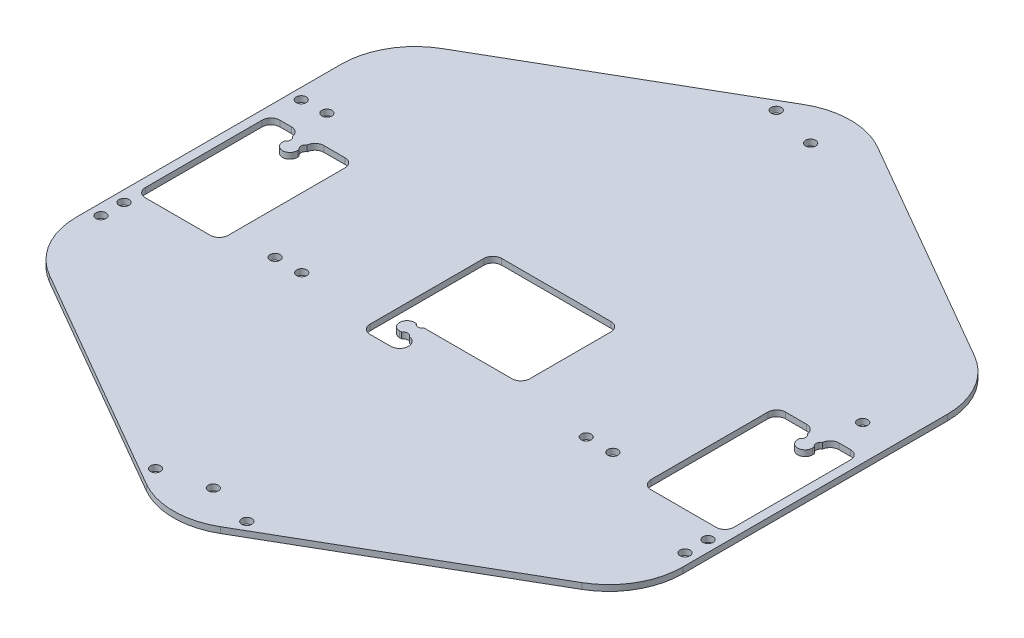
from build123d import *

# Parameters (mm, degrees)
BOSS_EXTRU_1_DEPTH                  = 2
ESQUISSE2_W                         = 28
ESQUISSE2_H                         = 45.5
ENL_V_MAT_EXTRU_1_DEPTH             = 157.584109453
BOSS_EXTRU_2_DEPTH                  = 2
ESQUISSE11_R                        = 1.6
ENL_V_MAT_EXTRU_2_DEPTH             = 157.584109453
CONG_7_R                            = 3
CONG_8_R                            = 25
DIAM_TRE_DU_PER_AGE_3_4_3_4_2_D     = 3.4
DIAM_TRE_DU_PER_AGE_3_4_3_4_2_DEPTH = 3
DIAM_TRE_DU_PER_AGE_3_4_3_4_2_TIP   = 1.021463052
D_GAGEMENT_M31_D                    = 3.4
D_GAGEMENT_M33_D                    = 3.4
D_GAGEMENT_M33_DEPTH                = 7
D_GAGEMENT_M33_TIP                  = 1.021463052
ENL_V_MAT_EXTRU_3_DEPTH             = 154.681644706
BOSS_EXTRU_3_DEPTH                  = 2
ESQUISSE40_R                        = 1.6
ENL_V_MAT_EXTRU_4_DEPTH             = 154.681644706
CONG_9_R                            = 3


with BuildPart() as part:
    # Esquisse1 → Boss.-Extru.1 (new body)
    with BuildSketch(Plane(origin=(0, 0, 0), x_dir=(1, 0, 0), z_dir=(0, 1, 0))):
        Polygon((-102.5, 59.178402592), (-102.5, -59.178402592), (0, -118.356805184), (102.5, -59.178402592), (102.5, 59.178402592), (0, 118.356805184), align=None)
    extrude(amount=BOSS_EXTRU_1_DEPTH)

    # Esquisse2 → Enlèv. mat.-Extru.1 (cut, through all)
    with BuildSketch(Plane(origin=(0, 2, 0), x_dir=(1, 0, 0), z_dir=(0, 1, 0))):
        with Locations((-85.5, -4.75)):
            Rectangle(ESQUISSE2_W, ESQUISSE2_H)
        with Locations((85.5, -4.75)):
            Rectangle(ESQUISSE2_W, ESQUISSE2_H)
    extrude(amount=-ENL_V_MAT_EXTRU_1_DEPTH, mode=Mode.SUBTRACT)

    # Esquisse10 → Boss.-Extru.2 (add)
    with BuildSketch(Plane(origin=(0, 2, 0), x_dir=(1, 0, 0), z_dir=(0, 1, 0))):
        with BuildLine():
            Line((89.6, 18), (89.6, 12))
            ThreePointArc((89.6, 12), (87.1, 9.5), (84.6, 12))
            Line((84.6, 12), (84.6, 18))
            Line((84.6, 18), (89.6, 18))
        make_face()
    boss_extru_2 = extrude(amount=-BOSS_EXTRU_2_DEPTH)

    # Esquisse11 → Enlèv. mat.-Extru.2 (cut, through all)
    with BuildSketch(Plane(origin=(0, 2, 0), x_dir=(1, 0, 0), z_dir=(0, 1, 0))):
        with Locations((83.75, 14)):
            Circle(ESQUISSE11_R)
        with Locations((90.45, 14)):
            Circle(ESQUISSE11_R)
    enl_v_mat_extru_2 = extrude(amount=-ENL_V_MAT_EXTRU_2_DEPTH, mode=Mode.SUBTRACT)

    # Symétrie4: Boss.-Extru.2, Enlèv. mat.-Extru.2 across plane
    add(boss_extru_2.mirror(Plane(origin=(0, 0, 0), x_dir=(0, 0, 1), z_dir=(1, 0, 0))))
    add(enl_v_mat_extru_2.mirror(Plane(origin=(0, 0, 0), x_dir=(0, 0, 1), z_dir=(1, 0, 0))), mode=Mode.SUBTRACT)

    # Congé7
    # the kernel refuses this fillet: 3 mm, written as the material it adds along each edge
    with BuildSketch(Plane(origin=(-89.6, 2, -18), x_dir=(0, 0, 1), z_dir=(0, -1, 0)), Plane(origin=(84.6, 2, -18), x_dir=(0, 0, 1), z_dir=(0, -1, 0))) as cong_7_piece_1:
        with BuildLine():
            CenterArc((3, 2.978856885), CONG_7_R, 180, 83.193609184)
            Line((0, 2.978856885), (-0.06, 2.978856885))
            Line((-0.06, 2.978856885), (-0.06, 0))
            Line((-0.06, 0), (0, -0.06))
            ThreePointArc((0, -0.06), (1.322227914, -0.06), (2.637344945, -0.059577138))
            Line((2.637344945, -0.059577138), (2.644455829, 0))
        make_face()
    extrude(amount=2)
    with BuildSketch(Plane(origin=(-71.5, 2, -18), x_dir=(0, 0, 1), z_dir=(0, -1, 0)), Plane(origin=(71.5, 2, -18), x_dir=(1, 0, 0), z_dir=(0, -1, 0)), Plane(origin=(-99.5, 2, -18), x_dir=(1, 0, 0), z_dir=(0, -1, 0)), Plane(origin=(-99.5, 2, 27.5), x_dir=(0, 0, -1), z_dir=(0, -1, 0)), Plane(origin=(99.5, 2, 27.5), x_dir=(-1, 0, 0), z_dir=(0, -1, 0)), Plane(origin=(99.5, 2, -18), x_dir=(0, 0, 1), z_dir=(0, -1, 0))) as cong_7_piece_2:
        with BuildLine():
            CenterArc((CONG_7_R, CONG_7_R), CONG_7_R, 180, 90)
            Line((0, CONG_7_R), (-CONG_7_R * 0.02, CONG_7_R))
            Line((-CONG_7_R * 0.02, CONG_7_R), (-CONG_7_R * 0.02, -CONG_7_R * 0.02))
            Line((-CONG_7_R * 0.02, -CONG_7_R * 0.02), (CONG_7_R, -CONG_7_R * 0.02))
            Line((CONG_7_R, -CONG_7_R * 0.02), (CONG_7_R, 0))
        make_face()
    extrude(amount=2)
    with BuildSketch(Plane(origin=(-84.6, 2, -18), x_dir=(1, 0, 0), z_dir=(0, -1, 0)), Plane(origin=(89.6, 2, -18), x_dir=(1, 0, 0), z_dir=(0, -1, 0))) as cong_7_piece_3:
        with BuildLine():
            CenterArc((2.978856885, 3), CONG_7_R, 186.806390816, 83.193609184)
            Line((0, 2.644455829), (-0.059577138, 2.637344945))
            ThreePointArc((-0.059577138, 2.637344945), (-0.06, 1.322227914), (-0.06, 0))
            Line((-0.06, 0), (0, -0.06))
            Line((0, -0.06), (2.978856885, -0.06))
            Line((2.978856885, -0.06), (2.978856885, 0))
        make_face()
    extrude(amount=2)
    with BuildSketch(Plane(origin=(-71.5, 2, 27.5), x_dir=(0, 0, -1), z_dir=(0, -1, 0)), Plane(origin=(71.5, 2, 27.5), x_dir=(1, 0, 0), z_dir=(0, -1, 0))) as cong_7_piece_4:
        with BuildLine():
            CenterArc((CONG_7_R, -CONG_7_R), CONG_7_R, 90, 90)
            Line((0, -CONG_7_R), (-CONG_7_R * 0.02, -CONG_7_R))
            Line((-CONG_7_R * 0.02, -CONG_7_R), (-CONG_7_R * 0.02, CONG_7_R * 0.02))
            Line((-CONG_7_R * 0.02, CONG_7_R * 0.02), (CONG_7_R, CONG_7_R * 0.02))
            Line((CONG_7_R, CONG_7_R * 0.02), (CONG_7_R, 0))
        make_face()
    extrude(amount=2)

    # Congé8
    cong_8_edges = [part.edges().sort_by_distance(p)[0] for p in [
        (0, 1, -118.356805184),
        (102.5, 1, -59.178402592),
        (102.5, 1, 59.178402592),
        (0, 1, 118.356805184),
        (-102.5, 1, 59.178402592),
        (-102.5, 1, -59.178402592),
    ]]
    fillet(cong_8_edges, radius=CONG_8_R)

    # Diamètre du perçage Ø3.4 (3.4)2
    with Locations(Plane(origin=(0, 2, 0), x_dir=(-1, 0, 0), z_dir=(0, 1, 0))):
        with Locations((0, -101), (0, 101)):
            Hole(DIAM_TRE_DU_PER_AGE_3_4_3_4_2_D / 2, depth=DIAM_TRE_DU_PER_AGE_3_4_3_4_2_DEPTH)
            with Locations((0, 0, -(DIAM_TRE_DU_PER_AGE_3_4_3_4_2_DEPTH + DIAM_TRE_DU_PER_AGE_3_4_3_4_2_TIP / 2))):  # 118° drill point
                Cone(0, DIAM_TRE_DU_PER_AGE_3_4_3_4_2_D / 2, DIAM_TRE_DU_PER_AGE_3_4_3_4_2_TIP, mode=Mode.SUBTRACT)

    # Dégagement M31 (through all)
    with Locations(Plane(origin=(0, 0, 0), x_dir=(-1, 0, 0), z_dir=(0, -1, 0))):
        with Locations((48.1, -23), (57.1, -23), (-57.1, -23), (-48.1, -23)):
            Hole(D_GAGEMENT_M31_D / 2)

    # Dégagement M33
    with Locations(Plane(origin=(0, 0, 0), x_dir=(-1, 0, 0), z_dir=(0, -1, 0))):
        with Locations((15.43813191, -105.113468551), (-15.43813191, -105.113468551), (-98.75, -40.25), (-98.75, -32.45), (-90.594469683, 27.994469683), (15.43813191, 104.789291724), (98.85, 27.55), (90.594469683, 27.994469683), (98.75, -40.25), (98.75, -32.45)):
            Hole(D_GAGEMENT_M33_D / 2, depth=D_GAGEMENT_M33_DEPTH)
            with Locations((0, 0, -(D_GAGEMENT_M33_DEPTH + D_GAGEMENT_M33_TIP / 2))):  # 118° drill point
                Cone(0, D_GAGEMENT_M33_D / 2, D_GAGEMENT_M33_TIP, mode=Mode.SUBTRACT)

    # Esquisse38 → Enlèv. mat.-Extru.3 (cut, through all)
    with BuildSketch(Plane(origin=(0, 2, 0), x_dir=(1, 0, 0), z_dir=(0, 1, 0))):
        Polygon((21.5, -18.5), (-8.5, -18.5), (-8.5, -29.5), (-21.5, -29.5), (-21.5, 15), (21.5, 15), align=None)
    extrude(amount=-ENL_V_MAT_EXTRU_3_DEPTH, mode=Mode.SUBTRACT)

    # Esquisse39 → Boss.-Extru.3 (add)
    with BuildSketch(Plane(origin=(0, 2, 0), x_dir=(1, 0, 0), z_dir=(0, 1, 0))):
        with BuildLine():
            Line((-8.5, -23.5), (-14.5, -23.5))
            ThreePointArc((-14.5, -23.5), (-17, -21), (-14.5, -18.5))
            Line((-14.5, -18.5), (-8.5, -18.5))
            ThreePointArc((-8.5, -18.5), (-6, -21), (-8.5, -23.5))
        make_face()
    extrude(amount=-BOSS_EXTRU_3_DEPTH)

    # Esquisse40 → Enlèv. mat.-Extru.4 (cut, through all)
    with BuildSketch(Plane(origin=(0, 2, 0), x_dir=(1, 0, 0), z_dir=(0, 1, 0))):
        with Locations((-12.5, -17.65)):
            Circle(ESQUISSE40_R)
        with Locations((-12.5, -24.35)):
            Circle(ESQUISSE40_R)
    extrude(amount=-ENL_V_MAT_EXTRU_4_DEPTH, mode=Mode.SUBTRACT)

    # Congé9
    # the kernel refuses this fillet: 3 mm, written as the material it adds along each edge
    with BuildSketch(Plane(origin=(21.5, 2, 18.5), x_dir=(-1, 0, 0), z_dir=(0, -1, 0)), Plane(origin=(21.5, 2, -15), x_dir=(0, 0, 1), z_dir=(0, -1, 0)), Plane(origin=(-21.5, 2, 29.5), x_dir=(0, 0, -1), z_dir=(0, -1, 0)), Plane(origin=(-8.5, 2, 29.5), x_dir=(-1, 0, 0), z_dir=(0, -1, 0))) as cong_9_piece_1:
        with BuildLine():
            CenterArc((CONG_9_R, CONG_9_R), CONG_9_R, 180, 90)
            Line((0, CONG_9_R), (-CONG_9_R * 0.02, CONG_9_R))
            Line((-CONG_9_R * 0.02, CONG_9_R), (-CONG_9_R * 0.02, -CONG_9_R * 0.02))
            Line((-CONG_9_R * 0.02, -CONG_9_R * 0.02), (CONG_9_R, -CONG_9_R * 0.02))
            Line((CONG_9_R, -CONG_9_R * 0.02), (CONG_9_R, 0))
        make_face()
    extrude(amount=2)
    with BuildSketch(Plane(origin=(-21.5, 2, -15), x_dir=(0, 0, 1), z_dir=(0, -1, 0))) as cong_9_piece_2:
        with BuildLine():
            CenterArc((CONG_9_R, -CONG_9_R), CONG_9_R, 90, 90)
            Line((0, -CONG_9_R), (-CONG_9_R * 0.02, -CONG_9_R))
            Line((-CONG_9_R * 0.02, -CONG_9_R), (-CONG_9_R * 0.02, CONG_9_R * 0.02))
            Line((-CONG_9_R * 0.02, CONG_9_R * 0.02), (CONG_9_R, CONG_9_R * 0.02))
            Line((CONG_9_R, CONG_9_R * 0.02), (CONG_9_R, 0))
        make_face()
    extrude(amount=2)
    with BuildSketch(Plane(origin=(-8.5, 2, 23.5), x_dir=(0, 0, 1), z_dir=(0, -1, 0))) as cong_9_piece_3:
        with BuildLine():
            CenterArc((2.978856885, 3), CONG_9_R, 186.806390816, 83.193609184)
            Line((0, 2.644455829), (-0.059577138, 2.637344945))
            ThreePointArc((-0.059577138, 2.637344945), (-0.06, 1.322227914), (-0.06, 0))
            Line((-0.06, 0), (0, -0.06))
            Line((0, -0.06), (2.978856885, -0.06))
            Line((2.978856885, -0.06), (2.978856885, 0))
        make_face()
    extrude(amount=2)


solid = part.part
